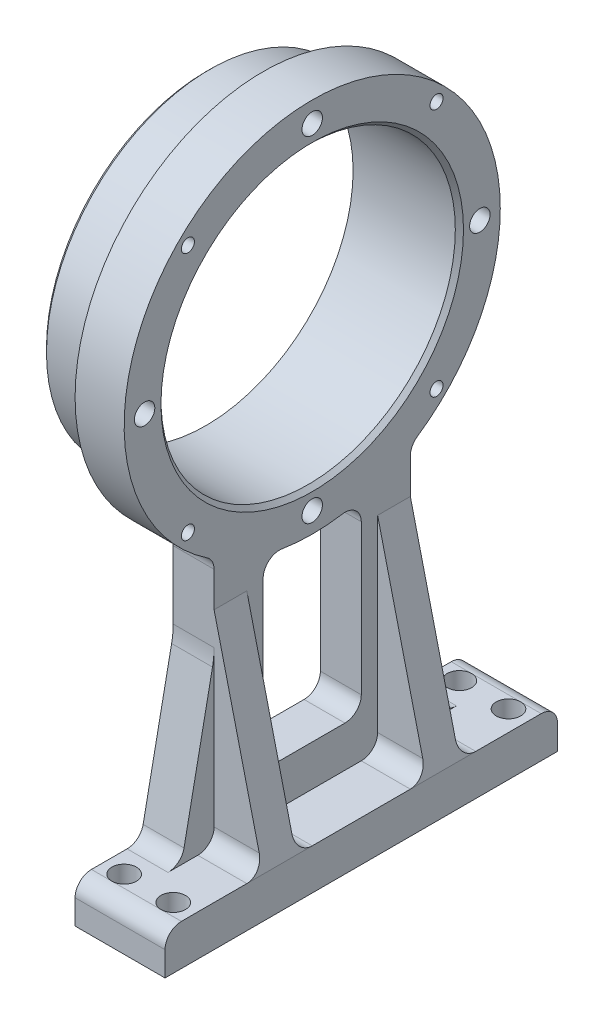
from build123d import *

# Parameters (mm, degrees)
EXTRUDE_1_DEPTH        = 5
SKETCH_16_W            = 48
SKETCH_16_H            = 5
EXTRUDE_3_DEPTH        = 11
CUT_EXTRUDE_4_REACH    = 84.486
SKETCH_5_R             = 1.5
RIB_1_REACH            = 68.821
SKETCH_17_WALL_W       = 161.351231242
SKETCH_17_WALL_H       = 4
FILLET_1_R             = 2
HOLE_WIZARD_M3_2_D     = 2.5
HOLE_WIZARD_M3_2_DEPTH = 5
HOLE_WIZARD_M3_2_TIP   = 0.751075774
HOLE_WIZARD_M2_1_D     = 1.6
CHAMFER_1_SIZE         = 0.5
FILLET_2_R             = 10


with BuildPart() as part:
    # 草图3 → 旋转1 (revolve)
    with BuildSketch(Plane.XY, mode=Mode.PRIVATE) as revolve_1_sk:
        Polygon((6, 18), (-7, 18), (-7, 20), (0, 20), (0, 23), (6, 23), align=None)
    revolve(revolve_1_sk.sketch.rotate(Axis((-123.647082632, 0, 0), (1, 0, 0)), 90), axis=Axis((-123.647082632, 0, 0), (1, 0, 0)))

    # 草图4 → 凸台-拉伸1 (add)
    with BuildSketch(Plane(origin=(6, 0, 0), x_dir=(0, 0, -1), z_dir=(1, 0, 0))):
        with BuildLine():
            Line((-12, -19.62141687), (-12, -30))
            Line((-12, -30), (-16, -50))
            Line((-16, -50), (-24, -50))
            Line((-24, -50), (-24, -55))
            Line((-24, -55), (24, -55))
            Line((24, -55), (24, -50))
            Line((24, -50), (16, -50))
            Line((16, -50), (12, -30))
            Line((12, -30), (12, -19.62141687))
            ThreePointArc((12, -19.62141687), (9.092135156, -21.126596467), (6, -22.203603311))
            Line((6, -22.203603311), (6, -45))
            Line((6, -45), (-6, -45))
            Line((-6, -45), (-6, -22.203603311))
            ThreePointArc((-6, -22.203603311), (-9.092135156, -21.126596467), (-12, -19.62141687))
        make_face()
    extrude(amount=-EXTRUDE_1_DEPTH)

    # 草图16 → 凸台-拉伸3 (add)
    with BuildSketch(Plane(origin=(1, 0, 0), x_dir=(0, 0, -1), z_dir=(1, 0, 0))):
        with Locations((0, -52.5)):
            Rectangle(SKETCH_16_W, SKETCH_16_H)
    extrude(amount=EXTRUDE_3_DEPTH)

    # 草图5 → 切除-拉伸4 (cut, up to next)
    with BuildSketch(Plane.XZ.offset(55), mode=Mode.PRIVATE) as cut_extrude_4_sk1:
        with Locations(Location((9.5, 20.5, 0), (0, 0, 270))):
            Circle(SKETCH_5_R)
    cut_extrude_4_tool1 = extrude(cut_extrude_4_sk1.sketch, amount=-CUT_EXTRUDE_4_REACH, mode=Mode.PRIVATE) & part.part
    # 草图5 → 切除-拉伸4 (cut, up to next)
    with BuildSketch(Plane.XZ.offset(55), mode=Mode.PRIVATE) as cut_extrude_4_sk2:
        with Locations(Location((9.5, -20.5, 0), (0, 0, 270))):
            Circle(SKETCH_5_R)
    cut_extrude_4_tool2 = extrude(cut_extrude_4_sk2.sketch, amount=-CUT_EXTRUDE_4_REACH, mode=Mode.PRIVATE) & part.part
    # 草图5 → 切除-拉伸4 (cut, up to next)
    with BuildSketch(Plane.XZ.offset(55), mode=Mode.PRIVATE) as cut_extrude_4_sk3:
        with Locations(Location((3.5, -20.5, 0), (0, 0, 270))):
            Circle(SKETCH_5_R)
    cut_extrude_4_tool3 = extrude(cut_extrude_4_sk3.sketch, amount=-CUT_EXTRUDE_4_REACH, mode=Mode.PRIVATE) & part.part
    # 草图5 → 切除-拉伸4 (cut, up to next)
    with BuildSketch(Plane.XZ.offset(55), mode=Mode.PRIVATE) as cut_extrude_4_sk4:
        with Locations(Location((3.5, 20.5, 0), (0, 0, 270))):
            Circle(SKETCH_5_R)
    cut_extrude_4_tool4 = extrude(cut_extrude_4_sk4.sketch, amount=-CUT_EXTRUDE_4_REACH, mode=Mode.PRIVATE) & part.part
    add(cut_extrude_4_tool1.solids().sort_by_distance((9.5, -55, 20.5))[0], mode=Mode.SUBTRACT)
    add(cut_extrude_4_tool2.solids().sort_by_distance((9.5, -55, -20.5))[0], mode=Mode.SUBTRACT)
    add(cut_extrude_4_tool3.solids().sort_by_distance((3.5, -55, -20.5))[0], mode=Mode.SUBTRACT)
    add(cut_extrude_4_tool4.solids().sort_by_distance((3.5, -55, 20.5))[0], mode=Mode.SUBTRACT)

    # 草图17 wall → 筋1 (add, up to next)
    with BuildSketch(Plane(origin=(9, -37.5, 12), x_dir=(0.233372952475, -0.972387301981, 0), z_dir=(0.972387301981, 0.233372952475, 0)), mode=Mode.PRIVATE) as rib_1_sk1:
        with Locations((0, 2)):
            Rectangle(SKETCH_17_WALL_W, SKETCH_17_WALL_H)
    rib_1_tool1 = extrude(rib_1_sk1.sketch, amount=-RIB_1_REACH, mode=Mode.PRIVATE) - part.part
    rib_1 = rib_1_tool1.solids().sort_by_distance((9, -37.5, 12))[0]
    add(rib_1)

    # 镜向1: 筋1 across plane
    add(rib_1.mirror(Plane.XY))

    # 圆角1
    fillet_1_edges = [part.edges().sort_by_distance(p)[0] for p in [
        (9, -50, 12),
        (9, -50, 8),
        (9, -50, -8),
        (9, -50, -12),
        (3.5, -22.203603311, -6),
        (3.5, -19.62141687, -12),
        (3.5, -50, -16),
        (6.5, -50, -24),
        (6.5, -50, 24),
        (3.5, -50, 16),
        (3.5, -19.62141687, 12),
        (3.5, -22.203603311, 6),
        (3.5, -45, 6),
        (3.5, -45, -6),
    ]]
    fillet(fillet_1_edges, radius=FILLET_1_R - 0.0001)  # a hair under: the kernel refuses the full size

    # M3 螺纹孔2
    with Locations(Plane(origin=(6, 0, 0), x_dir=(0, 0, -1), z_dir=(1, 0, 0))):
        with Locations((0, 20.5), (-20.5, 0), (0, -20.5), (20.5, 0)):
            Hole(HOLE_WIZARD_M3_2_D / 2, depth=HOLE_WIZARD_M3_2_DEPTH)
            with Locations((0, 0, -(HOLE_WIZARD_M3_2_DEPTH + HOLE_WIZARD_M3_2_TIP / 2))):  # 118° drill point
                Cone(0, HOLE_WIZARD_M3_2_D / 2, HOLE_WIZARD_M3_2_TIP, mode=Mode.SUBTRACT)

    # M2 螺纹孔1 (through all)
    with Locations(Plane(origin=(6, 0, 0), x_dir=(0, 0, -1), z_dir=(1, 0, 0))):
        with Locations((-15.202795796, 15.202795796), (15.202795796, 15.202795796), (15.202795796, -15.202795796), (-15.202795796, -15.202795796)):
            Hole(HOLE_WIZARD_M2_1_D / 2)

    # 倒角1
    chamfer_1_edges = [part.edges().sort_by_distance(p)[0] for p in [
        (6, 0, -18),
        (-7, 0, -20),
    ]]
    chamfer(chamfer_1_edges, length=CHAMFER_1_SIZE)

    # 圆角2
    fillet_2_edges = [part.edges().sort_by_distance(p)[0] for p in [
        (3.5, -30, 12),
        (3.5, -30, -12),
    ]]
    fillet(fillet_2_edges, radius=FILLET_2_R)


solid = part.part
